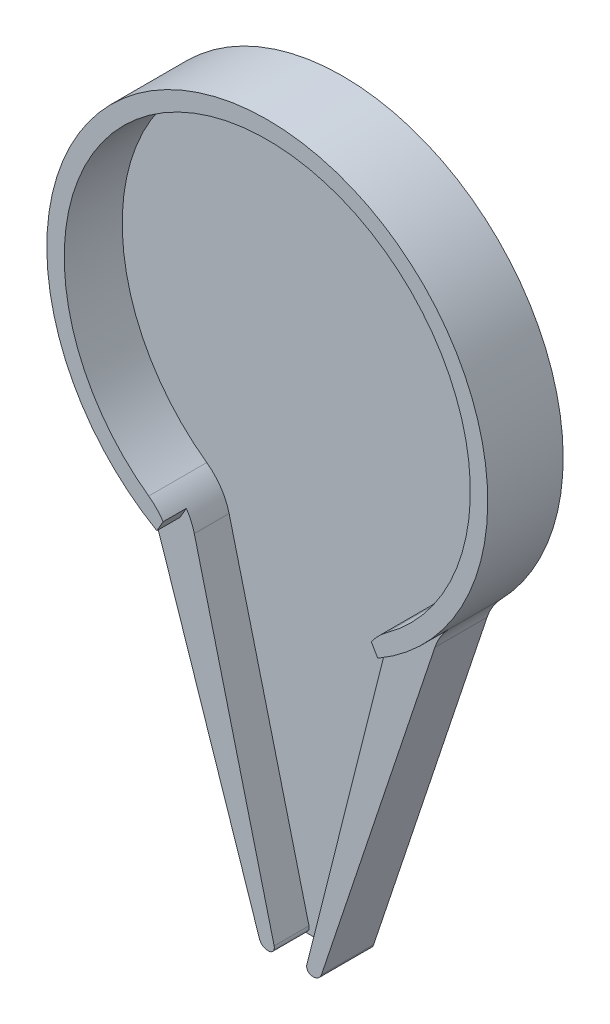
from build123d import *

# Parameters (mm, degrees)
ESQUISSE1_R             = 38
ESQUISSE1_R_2           = 35
BOSS_EXTRU_1_DEPTH      = 10
BOSS_EXTRU_2_START      = 3
ESQUISSE2_R             = 38
BOSS_EXTRU_2_DEPTH      = 3
BOSS_EXTRU_3_DEPTH      = 3
ENL_V_MAT_EXTRU_1_DEPTH = 99.203869578
BOSS_EXTRU_4_DEPTH      = 6
CONG_1_R                = 10
CONG_3_R                = 1
CONG_4_R                = 1.5


with BuildPart() as part:
    # Esquisse1 → Boss.-Extru.1 (new body)
    with BuildSketch(Plane.XY):
        Circle(ESQUISSE1_R)
        Circle(ESQUISSE1_R_2, mode=Mode.SUBTRACT)
    extrude(amount=BOSS_EXTRU_1_DEPTH)

    # Esquisse2 → Boss.-Extru.2 (add)
    with BuildSketch(Plane(origin=(0, 0, 0), x_dir=(-1, 0, 0), z_dir=(0, 0, -1)).offset(BOSS_EXTRU_2_START)):
        Circle(ESQUISSE2_R)
    extrude(amount=-BOSS_EXTRU_2_DEPTH)

    # Esquisse3 → Boss.-Extru.3 (add)
    with BuildSketch(Plane.XY):
        Polygon((-5, -90), (5, -90), (25.656199867, -28.0314004), (-25.656199867, -28.0314004), align=None)
    extrude(amount=-BOSS_EXTRU_3_DEPTH)

    # Esquisse4 → Enlèv. mat.-Extru.1 (cut, through all)
    with BuildSketch(Plane.XY):
        Polygon((-19.037588305, -32.887235085), (-17.534620807, -30.29087442), (17.534620807, -30.29087442), (19.037588305, -32.887235085), (0, -90), align=None)
    extrude(amount=ENL_V_MAT_EXTRU_1_DEPTH, mode=Mode.SUBTRACT)

    # Esquisse5 → Boss.-Extru.4 (add)
    with BuildSketch(Plane.XY):
        Polygon((-5, -90), (-25.656199867, -28.0314004), (-17.534620807, -30.29087442), (-2.5, -90), align=None)
        Polygon((2.5, -90), (5, -90), (25.656199867, -28.0314004), (17.534620807, -30.29087442), align=None)
    extrude(amount=BOSS_EXTRU_4_DEPTH)

    # Congé1
    # the kernel refuses this fillet: 10 mm, written as the material it adds along each edge
    with BuildSketch(Plane(origin=(25.656199867, -28.0314004, 6), x_dir=(0.7181222649547252, 0.6959169581036918, 0), z_dir=(0, 0, -1)), Plane(origin=(-25.656199867, -28.0314004, -3), x_dir=(-0.7181222649547252, 0.6959169581036918, 0), z_dir=(0, 0, 1))) as cong_1_piece_1:
        with BuildLine():
            CenterArc((2.451539853, 9.995936135), CONG_1_R, 242.53528085, 25.831208482)
            Line((-2.160483484, 1.122986189), (0, 0))
            ThreePointArc((0, 0), (1.08323854, 0.015442687), (2.16647708, 0))
        make_face()
    extrude(amount=9)
    # the kernel refuses this fillet: 10 mm, written as the material it takes off along each edge
    with BuildSketch(Plane(origin=(17.534620807, -30.29087442, 0), x_dir=(0.8396660922433514, 0.5431029861239759, 0), z_dir=(0, 0, 1))) as cong_1_2_piece_1:
        with BuildLine():
            CenterArc((3.949343583, -9.987807165), CONG_1_R, 92.829659135, 40.142072995)
            Line((-2.867030927, -2.670906281), (0, 0))
            ThreePointArc((0, 0), (1.727837818, -0.042674924), (3.455675635, 0))
        make_face()
    extrude(amount=15.795919653, mode=Mode.SUBTRACT)
    with BuildSketch(Plane(origin=(-17.534620807, -30.29087442, 0), x_dir=(-0.839666092243352, 0.5431029861239753, 0), z_dir=(0, 0, 1))) as cong_1_2_piece_2:
        with BuildLine():
            CenterArc((3.949343583, 9.987807165), CONG_1_R, 227.028267869, 40.142072995)
            Line((-2.867030927, 2.670906281), (0, 0))
            ThreePointArc((0, 0), (1.727837818, 0.042674924), (3.455675635, 0))
        make_face()
    extrude(amount=15.795919653, mode=Mode.SUBTRACT)

    # Congé3
    cong_3_edges = [part.edges().sort_by_distance(p)[0] for p in [
        (-2.5, -90, 3),
        (2.5, -90, 3),
    ]]
    fillet(cong_3_edges, radius=CONG_3_R)

    # Congé4
    cong_4_edges = [part.edges().sort_by_distance(p)[0] for p in [
        (-5, -90, 1.5),
        (5, -90, 1.5),
    ]]
    fillet(cong_4_edges, radius=CONG_4_R)


solid = part.part
